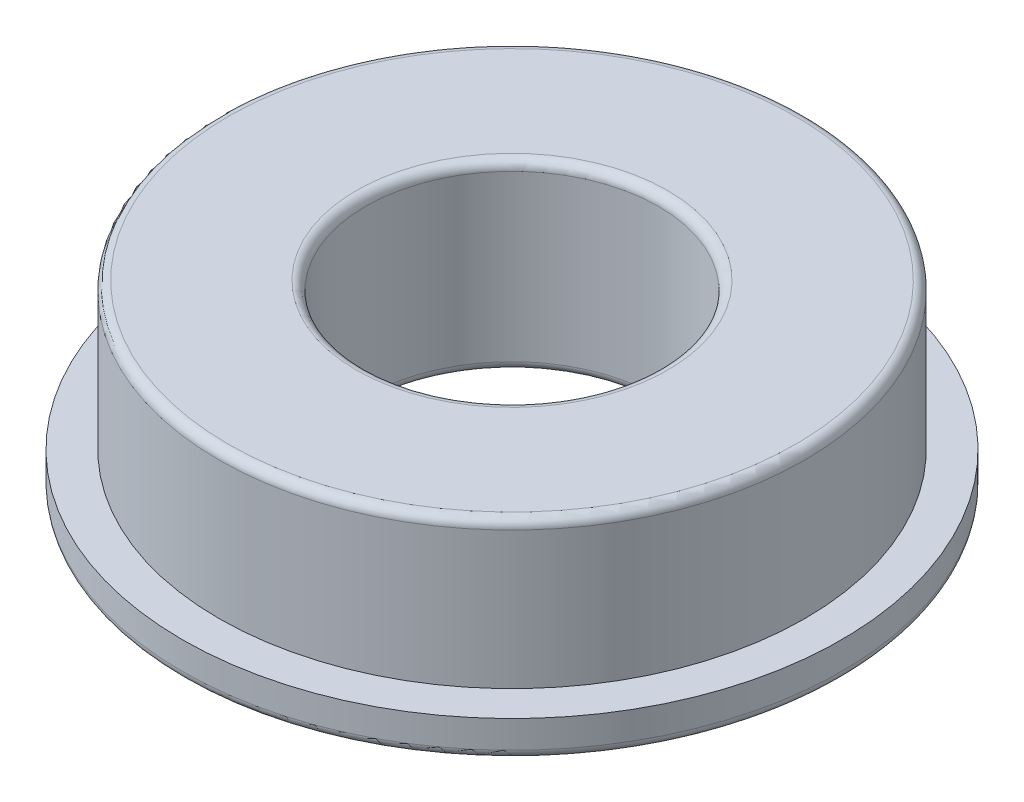
from build123d import *

# Parameters (mm, degrees)
CONG_1_R = 0.25


with BuildPart() as part:
    # Esquisse1 → Révolution1 (revolve)
    with BuildSketch(Plane.XY):
        Polygon((4, 5), (4, 0), (9, 0), (9, 1), (8, 1), (8, 5), align=None)
    revolve(axis=Axis((0, 0, 0), (0, 1, 0)))

    # Congé1
    cong_1_edges = [part.edges().sort_by_distance(p)[0] for p in [
        (-4, 0, 0),
        (-9, 0, 0),
        (-8, 5, 0),
        (-4, 5, 0),
    ]]
    fillet(cong_1_edges, radius=CONG_1_R)


solid = part.part
